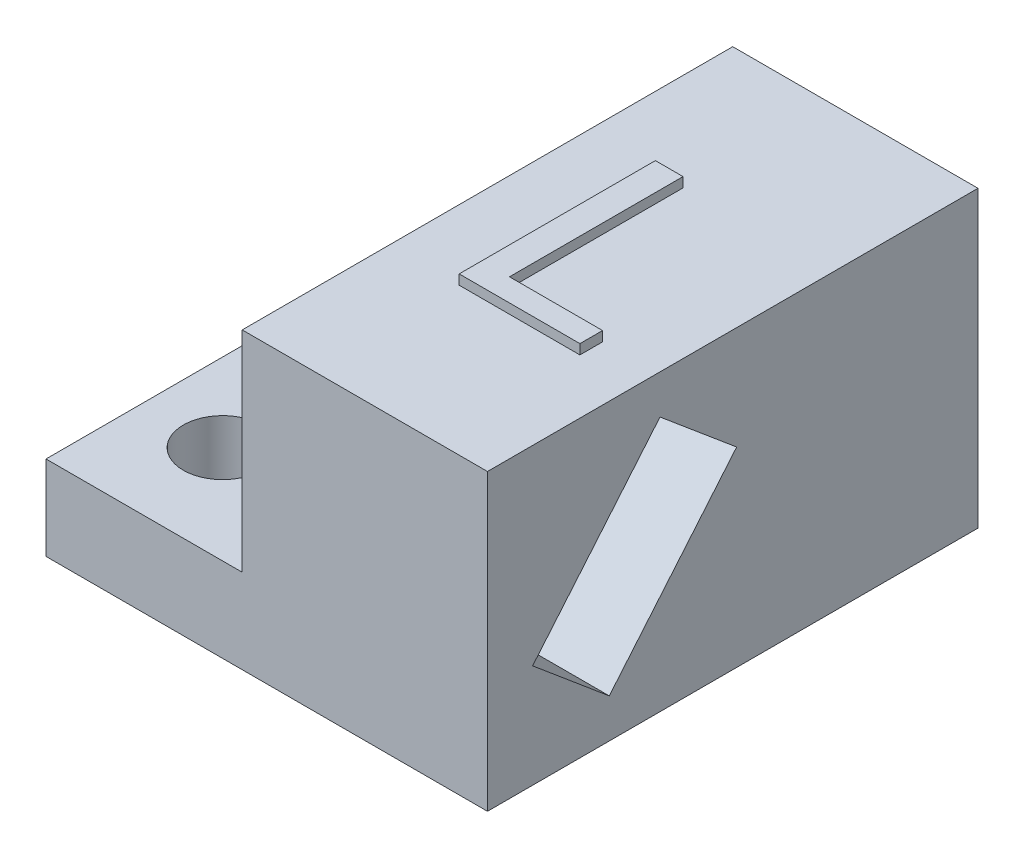
from build123d import *

# Parameters (mm, degrees)
SKETCH1_W           = 25
SKETCH1_H           = 50
BOSS_EXTRUDE1_DEPTH = 30
SKETCH2_W           = 50
SKETCH2_H           = 8.605036789
BOSS_EXTRUDE2_DEPTH = 20
SKETCH3_R           = 4
CUT_EXTRUDE1_DEPTH  = 47.249264327
CUT_EXTRUDE2_DEPTH  = 20
BOSS_EXTRUDE3_DEPTH = 1


with BuildPart() as part:
    # Sketch1 → Boss-Extrude1 (new body)
    with BuildSketch(Plane(origin=(0, 0, 0), x_dir=(1, 0, 0), z_dir=(0, 1, 0))):
        Rectangle(SKETCH1_W, SKETCH1_H)
    extrude(amount=BOSS_EXTRUDE1_DEPTH)

    # Sketch2 → Boss-Extrude2 (add)
    with BuildSketch(Plane.ZY.offset(12.5)):
        with Locations((0, 4.302518394)):
            Rectangle(SKETCH2_W, SKETCH2_H)
    extrude(amount=BOSS_EXTRUDE2_DEPTH)

    # Sketch3 → Cut-Extrude1 (cut, through all)
    with BuildSketch(Plane(origin=(0, 8.605036789, 0), x_dir=(1, 0, 0), z_dir=(0, 1, 0))):
        with Locations((-24.5, 15)):
            Circle(SKETCH3_R)
        with Locations((-24.5, -15)):
            Circle(SKETCH3_R)
    extrude(amount=-CUT_EXTRUDE1_DEPTH, mode=Mode.SUBTRACT)

    # Sketch4 → Cut-Extrude2 (cut)
    with BuildSketch(Plane(origin=(12.5, 0, 0), x_dir=(0, 0, -1), z_dir=(1, 0, 0))):
        Polygon((-12.585328198, 3.984734315), (0.398981518, 19.458832066), (-7.414671802, 26.015265685), (-20.398981518, 10.541167934), align=None)
    extrude(amount=-CUT_EXTRUDE2_DEPTH, mode=Mode.SUBTRACT)

    # Sketch5 → Boss-Extrude3 (add)
    with BuildSketch(Plane(origin=(0, 30, 0), x_dir=(1, 0, 0), z_dir=(0, 1, 0))):
        Polygon((-5.384615385, -10), (-5.384615385, 10), (-2.564102564, 10), (-2.564102564, -7.692307692), (6.923076923, -7.692307692), (6.923076923, -10), align=None)
    extrude(amount=BOSS_EXTRUDE3_DEPTH)


solid = part.part
